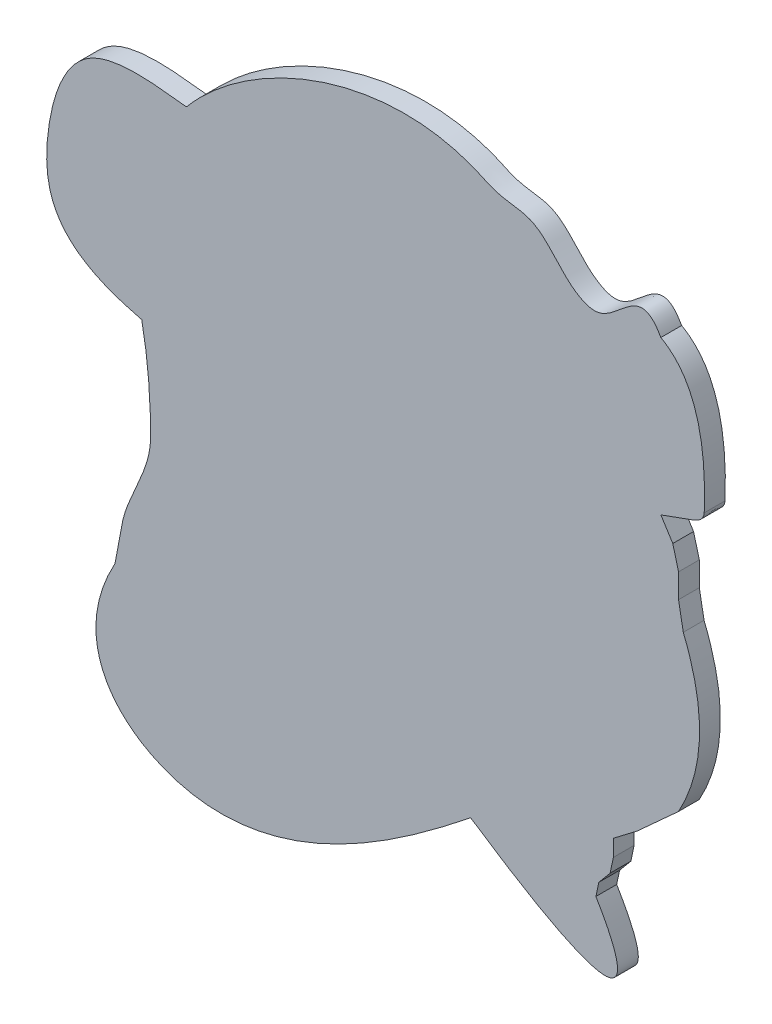
from build123d import *

# Parameters (mm, degrees)
BOSS_EXTRUDE2_DEPTH = 3.175


with BuildPart() as part:
    # Sketch1 → Boss-Extrude2 (new body)
    with BuildSketch(Plane.XY):
        with BuildLine():
            Line((158.848647409, 158.065989154), (159.287258197, 160.158039444))
            Line((159.287258197, 160.158039444), (161.024283069, 162.24246929))
            Line((161.024283069, 162.24246929), (161.51276424, 164.572387305))
            Line((161.51276424, 164.572387305), (161.51276424, 167.102297744))
            Line((161.51276424, 167.102297744), (165.183542032, 169.901250177))
            Line((165.183542032, 169.901250177), (171.472031107, 175.621746691))
            add(Edge.make_bspline(
                [(172.196352762, 199.687728108), (177.512545782, 186.611864968), (171.472031107, 175.621746691)],
                knots=[0, 0, 0, 1, 1, 1], degree=2))
            Line((172.196352762, 199.687728108), (171.472031107, 203.640454502))
            Line((171.472031107, 203.640454502), (171.472031107, 207.328620776))
            Line((171.472031107, 207.328620776), (170.591456875, 210.633600942))
            Line((170.591456875, 210.633600942), (168.77132287, 213.50749674))
            Line((168.77132287, 213.50749674), (173.762076079, 215.323183876))
            add(Edge.make_bspline(
                [(173.762076079, 215.323183876), (175.299052296, 215.889997376), (175.39725561, 217.089480705)],
                knots=[0, 0, 0, 1, 1, 1], degree=2))
            add(Edge.make_bspline(
                [(168.77132287, 236.972843892), (176.024535693, 232.91356426), (175.39725561, 217.089480705)],
                knots=[0, 0, 0, 1, 1, 1], degree=2))
            add(Edge.make_bspline(
                [(168.77132287, 236.972843892), (165.348333102, 243.181818321), (161.713024872, 233.590500252), (153.591853048, 237.311005477), (150.562230052, 243.292497992), (144.26627276, 243.172724883), (127.539588232, 251.709519765), (106.089408502, 242.945117572), (96.305367629, 231.252858967)],
                knots=[0, 0, 0, 0, 0.145953372, 0.187032347, 0.301264876, 0.367851833, 0.402074687, 1, 1, 1, 1], degree=3))
            add(Edge.make_bspline(
                [(89.47301913, 199.687728108), (76.414076731, 202.778398102), (72.921006176, 212.695352185), (79.130886224, 233.86725835), (92.35711514, 231.654519072), (96.305367629, 231.252858967)],
                knots=[0, 0, 0, 0, 0.435393148, 0.719886863, 1, 1, 1, 1], degree=3))
            add(Edge.make_bspline(
                [(89.47301913, 199.687728108), (90.449698127, 194.83749072), (90.825955315, 189.837761557), (90.838257386, 180.280743918), (87.678298822, 176.191377166), (86.590775441, 171.767770411)],
                knots=[0, 0, 0, 0, 0.517811069, 0.520823107, 1, 1, 1, 1], degree=3))
            Line((86.590775441, 171.767770411), (85.388246292, 165.381063893))
            add(Edge.make_bspline(
                [(85.388246292, 165.381063893), (78.04872596, 152.035766171), (100.062572602, 129.842406555), (127.319187547, 149.003850163), (139.710762388, 158.909562117)],
                knots=[0, 0, 0, 0, 0.355983936, 1, 1, 1, 1], degree=3))
            add(Edge.make_bspline(
                [(139.710762388, 158.909562117), (170.754327721, 138.111319354), (158.848647409, 158.065989154)],
                knots=[0, 0, 0, 1, 1, 1], degree=2))
        make_face()
    extrude(amount=BOSS_EXTRUDE2_DEPTH)


solid = part.part
